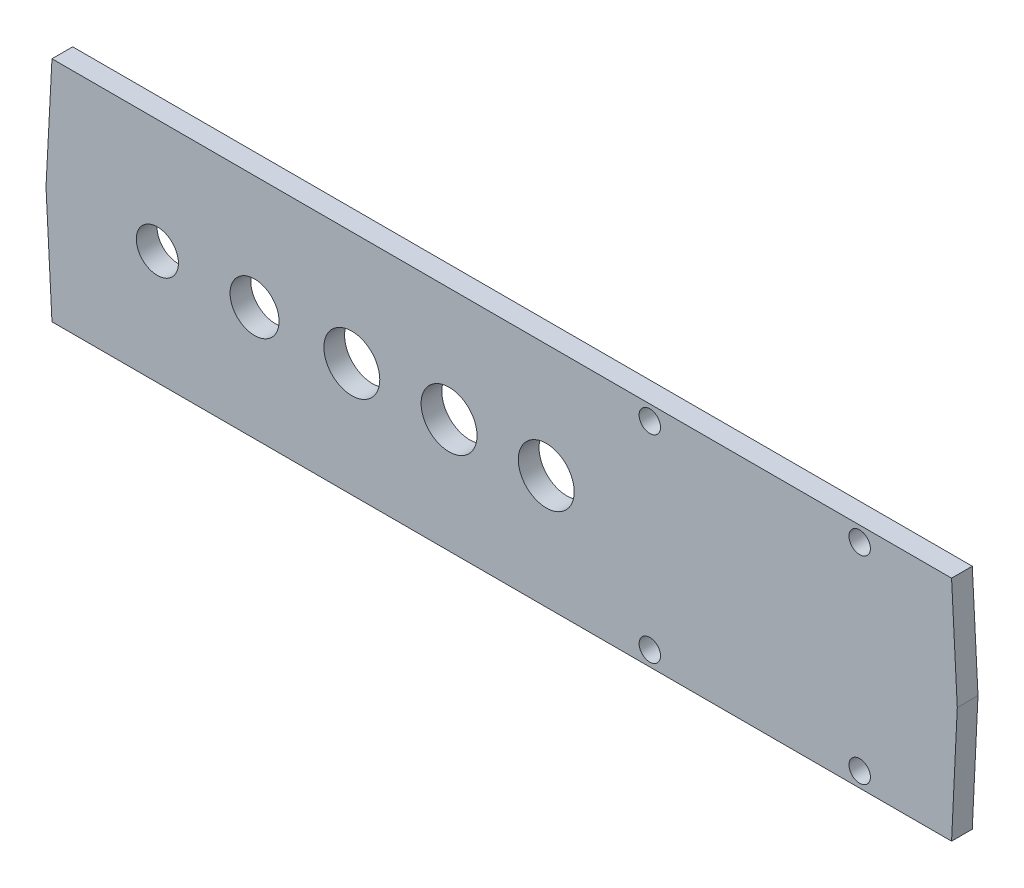
from build123d import *

# Parameters (mm, degrees)
BOSS_EXTRUDE1_DEPTH = 3
ESBO_O1_R           = 3.05
ESBO_O1_R_2         = 3.55
ESBO_O1_R_3         = 4.05
ESBO_O1_R_4         = 1.55
CUT_EXTRUDE2_DEPTH  = 10


# Read off the part's stored shape, not the designer's step: Boss-Extrude1
with BuildPart() as part:
    # Boss-Extrude1 outline → Boss-Extrude1 (new body)
    with BuildSketch(Plane.XY):
        Polygon((0, 0), (-0.86472917, -16.500015494), (0, -33.000030988), (130.305174389, -32.999992472), (131.13382584, -15.81161159), (130.305174389, 0), align=None)
    extrude(amount=BOSS_EXTRUDE1_DEPTH)

    # Esboço1 → Cut-Extrude2 (cut)
    with BuildSketch(Plane.XY.offset(3)):
        with Locations((15.264794979, -16.500000001)):
            Circle(ESBO_O1_R)
        with Locations((29.34491573, -16.500000001)):
            Circle(ESBO_O1_R_2)
        with Locations((43.432199078, -16.500000001)):
            Circle(ESBO_O1_R_3)
        with Locations((57.519151999, -16.500000001)):
            Circle(ESBO_O1_R_3)
        with Locations((71.597045458, -16.500000001)):
            Circle(ESBO_O1_R_3)
        with Locations((86.59615234, -2.1587967)):
            Circle(ESBO_O1_R_4)
        with Locations((116.99615234, -2.1587967)):
            Circle(ESBO_O1_R_4)
        with Locations((86.59615234, -30.8412033)):
            Circle(ESBO_O1_R_4)
        with Locations((116.99615234, -30.8412033)):
            Circle(ESBO_O1_R_4)
    extrude(amount=-CUT_EXTRUDE2_DEPTH, mode=Mode.SUBTRACT)


solid = part.part
